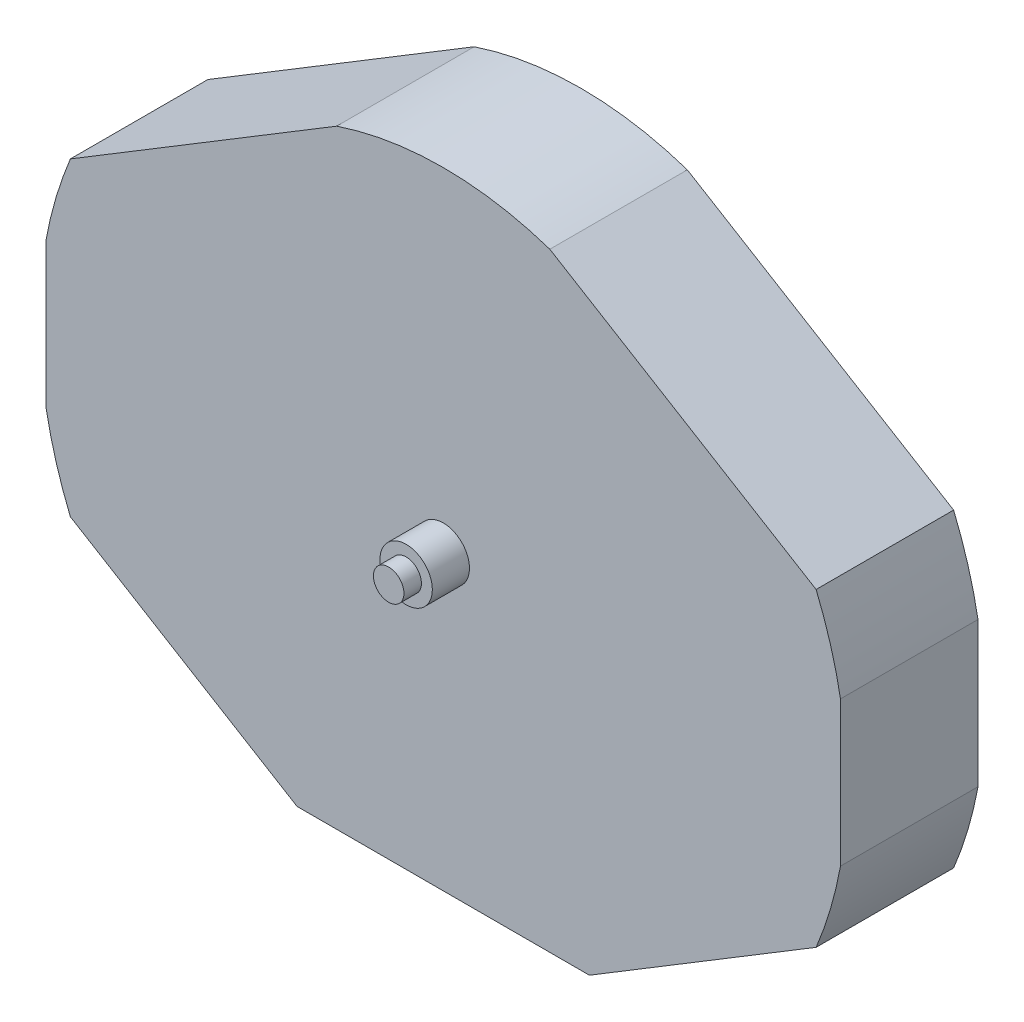
from build123d import *

# Parameters (mm, degrees)
BOSS_EXTRU_1_DEPTH = 3.15
ESQUISSE4_R        = 0.6
BOSS_EXTRU_2_DEPTH = 0.85
ESQUISSE5_R        = 0.35
BOSS_EXTRU_3_DEPTH = 0.4


with BuildPart() as part:
    # Esquisse2 → Boss.-Extru.1 (new body)
    with BuildSketch(Plane.XY):
        with BuildLine():
            Line((9.1, 1.659066002), (9.1, -1.659066002))
            ThreePointArc((9.1, -1.659066002), (8.871356868, -2.619451721), (8.541662602, -3.55))
            Line((8.541662602, -3.55), (3.348120127, -6.7))
            Line((3.348120127, -6.7), (-3.348120127, -6.7))
            Line((-3.348120127, -6.7), (-8.541662602, -3.55))
            ThreePointArc((-8.541662602, -3.55), (-8.871356868, -2.619451721), (-9.1, -1.659066002))
            Line((-9.1, -1.659066002), (-9.1, 1.659066002))
            ThreePointArc((-9.1, 1.659066002), (-8.871356868, 2.619451721), (-8.541662602, 3.55))
            Line((-8.541662602, 3.55), (-2.441311123, 7.25))
            ThreePointArc((-2.441311123, 7.25), (0, 7.65), (2.441311123, 7.25))
            Line((2.441311123, 7.25), (8.541662602, 3.55))
            ThreePointArc((8.541662602, 3.55), (8.871356868, 2.619451721), (9.1, 1.659066002))
        make_face()
    extrude(amount=BOSS_EXTRU_1_DEPTH)

    # Esquisse4 → Boss.-Extru.2 (add)
    with BuildSketch(Plane.XY.offset(3.15)):
        Circle(ESQUISSE4_R)
    extrude(amount=BOSS_EXTRU_2_DEPTH)

    # Esquisse5 → Boss.-Extru.3 (add)
    with BuildSketch(Plane.XY.offset(4)):
        Circle(ESQUISSE5_R)
    extrude(amount=BOSS_EXTRU_3_DEPTH)


solid = part.part
